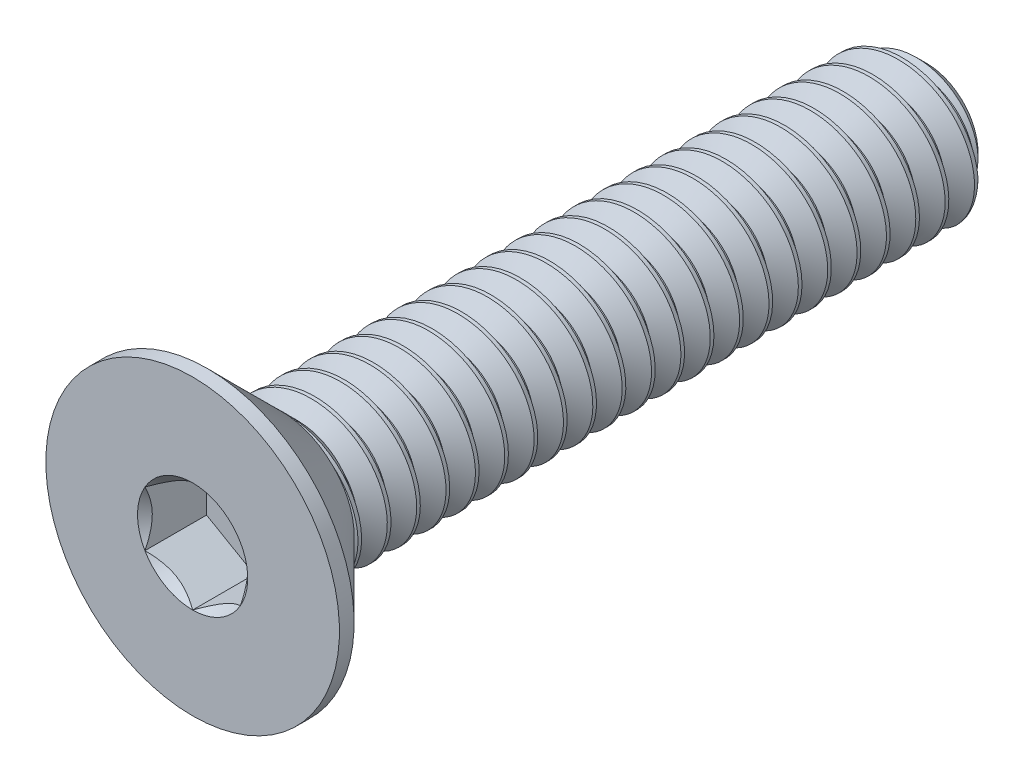
from build123d import *
from build123d.topology import SkipClean

# Parameters (mm, degrees)
SKETCH1_W          = 10
SKETCH1_H          = 1
CHAMFER1_SIZE      = 0.3
CUT_SWEEP1_PITCH   = 0.4
CUT_EXTRUDE2_DEPTH = 0.84


with BuildPart() as part:
    # Sketch1 → Revolve1 (revolve)
    with BuildSketch(Plane(origin=(0, 0, 0), x_dir=(0, 0, -1), z_dir=(1, 0, 0))):
        with Locations((5, 0.5)):
            Rectangle(SKETCH1_W, SKETCH1_H)
    revolve(axis=Axis((0, 0, -10), (0, 0, 1)))

    # Chamfer1
    chamfer1_edges = [part.edges().sort_by_distance(p)[0] for p in [
        (0, -1, -10),
    ]]
    chamfer(chamfer1_edges, length=CHAMFER1_SIZE)

    # Cut-Sweep1: arcs per turn and ends read off the stored shape
    # Cut-Sweep1: the profile of Sketch2 profile screwed along a right-hand helix through 26 turns, 6 arcs to a turn; built about Z, then put on its axis
    cut_sweep1_z = Axis((0, 0, 0), (0, 0, 1))
    cut_sweep1_corners = [(1.0003, 0, 0.000173205), (1.0003, 0, -0.350173205), (0.740192379, 0, -0.2), (0.740192379, 0, -0.15)]
    with BuildLine(mode=Mode.PRIVATE) as cut_sweep1_profile:
        Line(cut_sweep1_corners[0], cut_sweep1_corners[1])
        Line(cut_sweep1_corners[1], cut_sweep1_corners[2])
        Line(cut_sweep1_corners[2], cut_sweep1_corners[3])
        Line(cut_sweep1_corners[3], cut_sweep1_corners[0])
    cut_sweep1_cap = Face(cut_sweep1_profile.wire())
    cut_sweep1_turn_angles = [0, 30, 60, 90, 120, 150, 180, 210, 240, 270, 300, 330, 360]
    cut_sweep1_turn_weights = [1, 0.8660254037844387, 1, 0.8660254037844387, 1, 0.8660254037844387, 1, 0.8660254037844387, 1, 0.8660254037844387, 1, 0.8660254037844387, 1]
    cut_sweep1_turn_rails = [Edge.make_bspline([Vector(p[0], p[1], 0).rotate(cut_sweep1_z, cut_sweep1_turn_angles[k]) / cut_sweep1_turn_weights[k] + Vector(0, 0, p[2] + CUT_SWEEP1_PITCH * cut_sweep1_turn_angles[k] / 360) for k in range(13)], [0, 0, 0, 1, 1, 2, 2, 3, 3, 4, 4, 5, 5, 6, 6, 6], 2, cut_sweep1_turn_weights) for p in cut_sweep1_corners]
    cut_sweep1_turn_sides = [Face.make_surface_from_curves(cut_sweep1_turn_rails[p[0]], cut_sweep1_turn_rails[p[1]]) for p in [(0, 1), (1, 2), (2, 3), (3, 0)]]
    cut_sweep1_turn = Solid(Shell([*cut_sweep1_turn_sides, cut_sweep1_cap, cut_sweep1_cap.rotate(cut_sweep1_z, 360).moved(Location((0, 0, CUT_SWEEP1_PITCH * 360 / 360)))]))
    cut_sweep1_each = [*[cut_sweep1_turn.moved(Location((0, 0, CUT_SWEEP1_PITCH * i))) for i in range(26)]]
    add(Plane(origin=(0, 0, -10), x_dir=(0, 1, 0), z_dir=(0, 0, 1)) * Compound([cut_sweep1_each[i] for i in range(0, 26, 2)]), mode=Mode.SUBTRACT)
    add(Plane(origin=(0, 0, -10), x_dir=(0, 1, 0), z_dir=(0, 0, 1)) * Compound([cut_sweep1_each[i] for i in range(1, 26, 2)]), mode=Mode.SUBTRACT)

    # Sketch7 → Revolve2 (revolve)
    with BuildSketch(Plane(origin=(0, 0, 0), x_dir=(0, 0, -1), z_dir=(1, 0, 0)), mode=Mode.PRIVATE) as revolve2_sk:
        Polygon((0, 2), (0.2, 2), (1.2, 1), (1.2, 0), (0, 0), align=None)
    revolve(revolve2_sk.sketch.rotate(Axis((0, 0, 0), (0, 0, -1)), 189.336081704), axis=Axis((0, 0, 0), (0, 0, -1)))

    # Boss-Extrude1 cone 1 section (through the dimple's axis) → Boss-Extrude1 (revolve)
    with SkipClean():  # the faces are left unmerged after this step: merging them gives an invalid solid
        with BuildSketch(Plane(origin=(0, 0, -1.2), x_dir=(0, -1, 0), z_dir=(1, 0, 0))):
            Polygon((0, 0), (1, 0), (0, 1), align=None)
        revolve(axis=Axis((0, 0, -1.2), (0, 0, -1)))

    # Sketch5 → Cut-Extrude2 (cut)
    with SkipClean():  # the faces are left unmerged after this step: merging them gives an invalid solid
        with BuildSketch(Plane.XY):
            Polygon((0.65, -0.375277675), (0.65, 0.375277675), (0, 0.75055535), (-0.65, 0.375277675), (-0.65, -0.375277675), (0, -0.75055535), align=None)
        extrude(amount=-CUT_EXTRUDE2_DEPTH, mode=Mode.SUBTRACT)

    # Cut-Extrude3 cone 1 section (through the dimple's axis) → Cut-Extrude3 (revolve, cut)
    with SkipClean():  # the faces are left unmerged after this step: merging them gives an invalid solid
        with BuildSketch(Plane(origin=(0, 0, 0), x_dir=(0, -1, 0), z_dir=(1, 0, 0))):
            Polygon((0, 0), (0.75055535, 0), (0, 0.75055535), align=None)
        revolve(axis=Axis((0, 0, 0), (0, 0, -1)), mode=Mode.SUBTRACT)


solid = part.part
